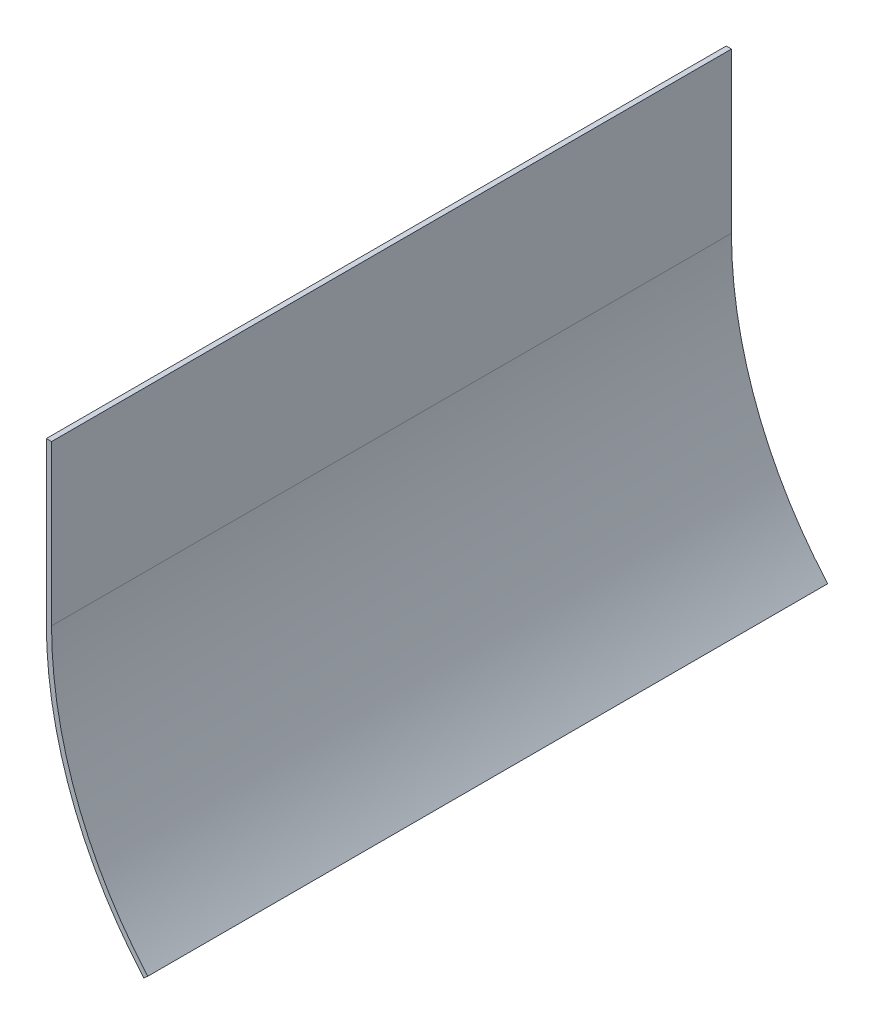
from build123d import *

# Parameters (mm, degrees)
BOSS_EXTRUDE1_DEPTH = 412.75


with BuildPart() as part:
    # Sketch1 → Boss-Extrude1 (new body)
    with BuildSketch(Plane.XY):
        with BuildLine():
            Line((812.541689005, 1387.369803868), (812.541689005, 1484.270803868))
            Line((812.541689005, 1484.270803868), (815.716689005, 1484.270803868))
            Line((815.716689005, 1484.270803868), (815.716689005, 1387.369803868))
            ThreePointArc((815.716689005, 1387.369803868), (830.808178648, 1304.545262303), (874.142862637, 1232.366574946))
            Line((874.142862637, 1232.366574946), (871.757832535, 1230.270803868))
            ThreePointArc((871.757832535, 1230.270803868), (827.837227995, 1303.425406414), (812.541689005, 1387.369803868))
        make_face()
    extrude(amount=BOSS_EXTRUDE1_DEPTH)


solid = part.part
